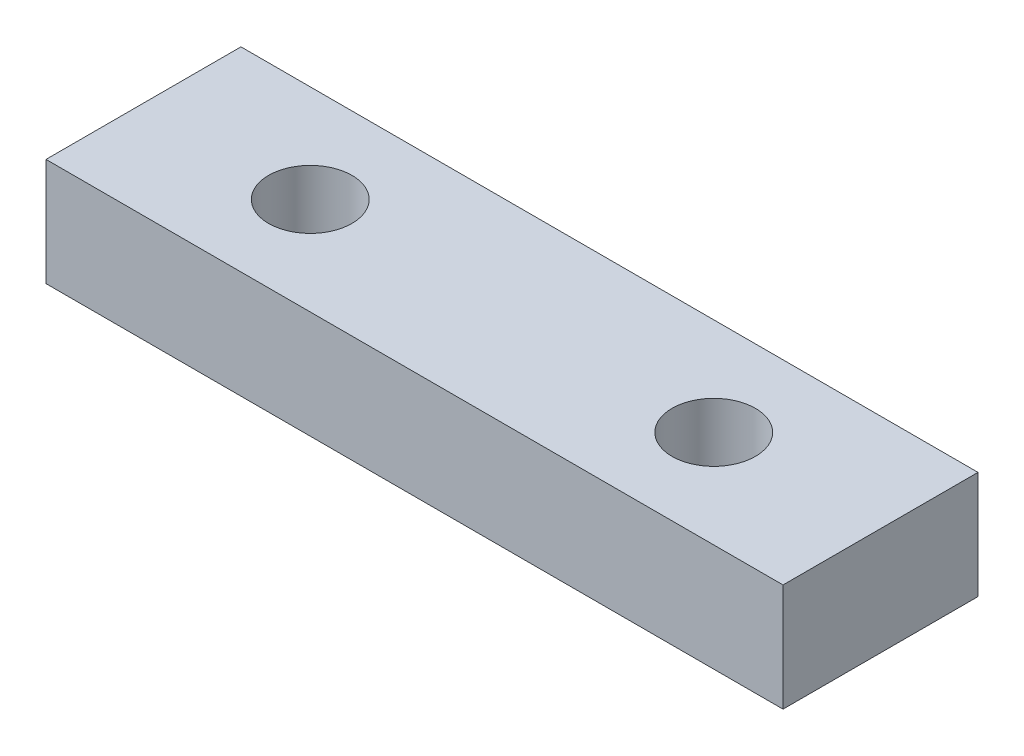
from build123d import *

# Parameters (mm, degrees)
SKETCH1_W           = 27.4
SKETCH1_H           = 7.247877258
SKETCH1_R           = 1.55
BOSS_EXTRUDE1_DEPTH = 4


with BuildPart() as part:
    # Sketch1 → Boss-Extrude1 (new body)
    with BuildSketch(Plane(origin=(0, 0, 0), x_dir=(1, 0, 0), z_dir=(0, 1, 0))):
        with Locations((0, -3.623938629)):
            Rectangle(SKETCH1_W, SKETCH1_H)
        with Locations((7.5, -3.623938629)):
            Circle(SKETCH1_R, mode=Mode.SUBTRACT)
        with Locations((-7.5, -3.623938629)):
            Circle(SKETCH1_R, mode=Mode.SUBTRACT)
    extrude(amount=BOSS_EXTRUDE1_DEPTH)


solid = part.part
